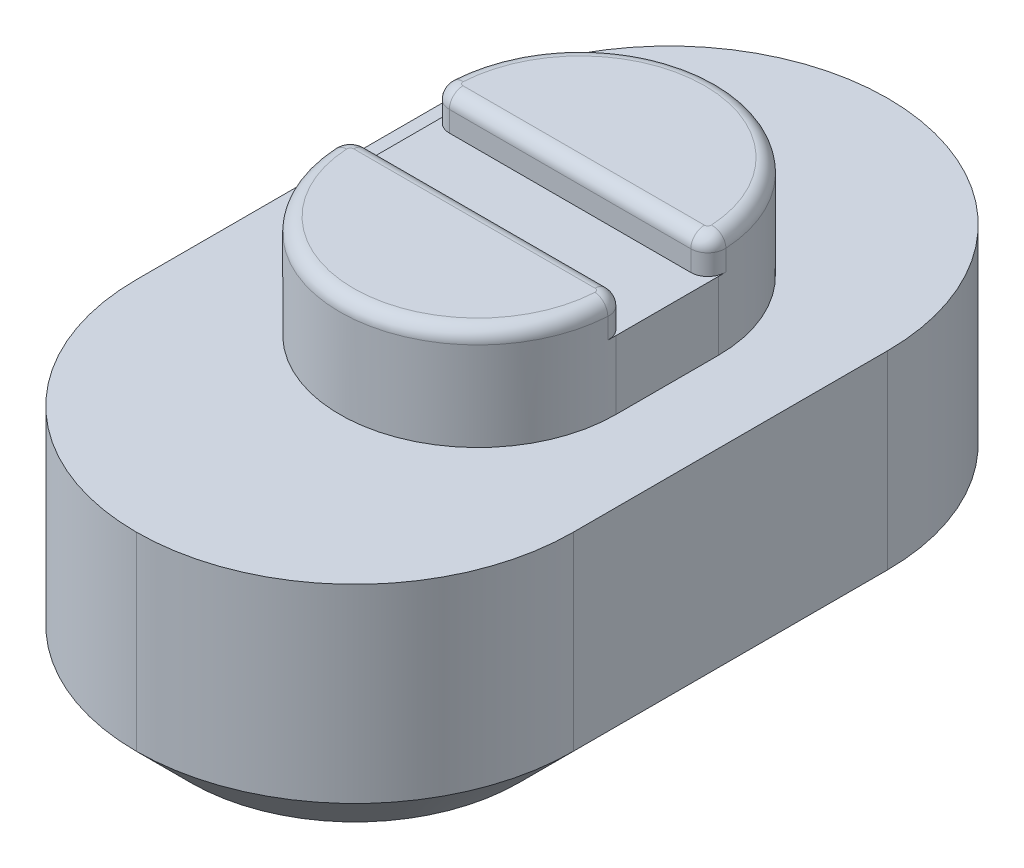
from build123d import *

# Parameters (mm, degrees)
SKETCH_1_W              = 6.4
SKETCH_1_H              = 11
EXTRUDE_1_DEPTH         = 3.678333878
FILLET_1_R              = 3.2
EXTRUDE_2_DEPTH         = 1.5
SKETCH_3_W              = 4.04000003
SKETCH_3_H              = 1.2
CUT_EXTRUDE_1_DEPTH     = 0.5
FILLET_2_R              = 0.25
FILLET_3_R              = 0.2
OTHER_2_OUTLINE_W       = 1.5
OTHER_2_OUTLINE_H       = 1.5
OTHER_2_DEPTH           = 2
SKETCH_5_W              = 1.8
SKETCH_5_H              = 1.8
CUT_EXTRUDE_2_DEPTH     = 5.4
CUT_EXTRUDE_START       = -0.1
CUT_EXTRUDE_3_OUTLINE_W = 10
CUT_EXTRUDE_3_OUTLINE_H = 14
CUT_EXTRUDE_3_DEPTH     = 0.1
CHAMFER_1_SIZE          = 0.8


# Read off the part's stored shape, not the designer's step: 压凹2, 切除-拉伸3
# Some blends are built 0.0001 mm under size
with BuildPart() as part:
    # 草图1 → 凸台-拉伸1 (new body)
    with BuildSketch(Plane(origin=(0, 0, 0), x_dir=(1, 0, 0), z_dir=(0, 1, 0))):
        Rectangle(SKETCH_1_W, SKETCH_1_H)
    extrude(amount=EXTRUDE_1_DEPTH)

    # 圆角1
    fillet_1_edges = [part.edges().sort_by_distance(p)[0] for p in [
        (-3.2, 1.839166939, -5.5),
        (3.2, 1.839166939, -5.5),
        (3.2, 1.839166939, 5.5),
        (-3.2, 1.839166939, 5.5),
    ]]
    fillet(fillet_1_edges, radius=FILLET_1_R - 0.0001)  # a hair under: the kernel refuses the full size

    # 草图2 → 凸台-拉伸2 (add)
    with BuildSketch(Plane(origin=(0, 3.678333878, 0), x_dir=(1, 0, 0), z_dir=(0, 1, 0))):
        with BuildLine():
            Line((2.020000015, 1), (2.020000015, -0.5))
            ThreePointArc((2.020000015, -0.5), (0, -2.520000015), (-2.020000015, -0.5))
            Line((-2.020000015, -0.5), (-2.020000015, 1))
            ThreePointArc((-2.020000015, 1), (1.5e-08, 3.02), (2.020000015, 1))
        make_face()
    extrude(amount=EXTRUDE_2_DEPTH)

    # 草图3 → 切除-拉伸1 (cut)
    with BuildSketch(Plane(origin=(0, 5.178333878, 0), x_dir=(1, 0, 0), z_dir=(0, 1, 0))):
        with Locations((0, 0.25)):
            Rectangle(SKETCH_3_W, SKETCH_3_H)
    extrude(amount=-CUT_EXTRUDE_1_DEPTH, mode=Mode.SUBTRACT)

    # 圆角2
    # the kernel refuses this fillet: 0.25 mm, written as the material it takes off along each edge
    with BuildSketch(Plane(origin=(2.020000015, 5.838693877, 0.35), x_dir=(-0.012214651008913897, 0, 0.9999253983676635), z_dir=(0, -1, 0))) as fillet_2_piece_1:
        with BuildLine():
            CenterArc((0.253069545, 0.249754592), FILLET_2_R, 179.300134646, 93.238774214)
            Line((0.003088195, 0.252808255), (-0.02190994, 0.253113621))
            Line((-0.02190994, 0.253113621), (-0.024998135, 0.000305366))
            Line((-0.024998135, 0.000305366), (-0.000305366, -0.024998135))
            ThreePointArc((-0.000305366, -0.024998135), (0.149683443, -0.026830333), (0.265251445, -0.024975459))
            Line((0.265251445, -0.024975459), (0.264143999, 0))
        make_face()
    extrude(amount=1.160359998, mode=Mode.SUBTRACT)
    with BuildSketch(Plane(origin=(2.020000015, 5.838693882, -0.85), x_dir=(-0.012214654567378504, 0, -0.9999253983241949), z_dir=(0, -1, 0))) as fillet_2_piece_2:
        with BuildLine():
            CenterArc((0.253069545, -0.249754592), FILLET_2_R, 87.46109086, 93.238774699)
            Line((0.003088196, -0.252808256), (-0.021909939, -0.253113622))
            Line((-0.021909939, -0.253113622), (-0.024998135, -0.000305366))
            Line((-0.024998135, -0.000305366), (-0.000305366, 0.024998135))
            ThreePointArc((-0.000305366, 0.024998135), (0.149683444, 0.026830333), (0.265251447, 0.024975459))
            Line((0.265251447, 0.024975459), (0.264144001, 0))
        make_face()
    extrude(amount=1.160360003, mode=Mode.SUBTRACT)
    with BuildSketch(Plane(origin=(-2.020000015, 5.838693877, 0.35), x_dir=(0.012214651008913804, 0, 0.9999253983676635), z_dir=(0, -1, 0))) as fillet_2_piece_3:
        with BuildLine():
            CenterArc((0.253069545, -0.249754592), FILLET_2_R, 87.461091141, 93.238774214)
            Line((0.003088195, -0.252808255), (-0.02190994, -0.253113621))
            Line((-0.02190994, -0.253113621), (-0.024998135, -0.000305366))
            Line((-0.024998135, -0.000305366), (-0.000305366, 0.024998135))
            ThreePointArc((-0.000305366, 0.024998135), (0.149683443, 0.026830333), (0.265251445, 0.024975459))
            Line((0.265251445, 0.024975459), (0.264143999, 0))
        make_face()
    extrude(amount=1.160359998, mode=Mode.SUBTRACT)
    with BuildSketch(Plane(origin=(-2.020000015, 5.838693882, -0.85), x_dir=(0.012214654567376798, 0, -0.9999253983241947), z_dir=(0, -1, 0))) as fillet_2_piece_4:
        with BuildLine():
            CenterArc((0.253069545, 0.249754592), FILLET_2_R, 179.300134442, 93.238774699)
            Line((0.003088196, 0.252808256), (-0.021909939, 0.253113622))
            Line((-0.021909939, 0.253113622), (-0.024998135, 0.000305366))
            Line((-0.024998135, 0.000305366), (-0.000305366, -0.024998135))
            ThreePointArc((-0.000305366, -0.024998135), (0.149683444, -0.026830333), (0.265251447, -0.024975459))
            Line((0.265251447, -0.024975459), (0.264144001, 0))
        make_face()
    extrude(amount=1.160360003, mode=Mode.SUBTRACT)

    # 圆角3
    fillet_3_edges = [part.edges().sort_by_distance(p)[0] for p in [
        (0, 5.178333878, 2.520000015),
        (0, 5.178333878, 0.35),
        (-1.948874678, 5.178333878, 0.428289595),
        (1.948874678, 5.178333878, 0.428289595),
        (0, 5.178333878, -0.85),
        (0, 5.178333878, -3.02),
        (-1.948874678, 5.178333878, -0.928289595),
        (1.948874678, 5.178333878, -0.928289595),
    ]]
    fillet(fillet_3_edges, radius=FILLET_3_R)

    # 压凹2 outline → 压凹2 (cut)
    with BuildSketch(Plane(origin=(0, 0, 0), x_dir=(1, 0, 0), z_dir=(0, 1, 0))):
        with Locations((0, 1)):
            Rectangle(OTHER_2_OUTLINE_W, OTHER_2_OUTLINE_H)
    extrude(amount=OTHER_2_DEPTH, mode=Mode.SUBTRACT)

    # 草图5 → 切除-拉伸2 (cut)
    with BuildSketch(Plane.XZ.offset(-2)):
        with Locations((0, -1)):
            Rectangle(SKETCH_5_W, SKETCH_5_H)
    extrude(amount=CUT_EXTRUDE_2_DEPTH, mode=Mode.SUBTRACT)

    # 切除-拉伸3 outline → 切除-拉伸3 (cut)
    with BuildSketch(Plane.XZ.offset(CUT_EXTRUDE_START)):
        Rectangle(CUT_EXTRUDE_3_OUTLINE_W, CUT_EXTRUDE_3_OUTLINE_H)
    extrude(amount=CUT_EXTRUDE_3_DEPTH, mode=Mode.SUBTRACT)

    # 倒角1
    chamfer_1_edges = [part.edges().sort_by_distance(p)[0] for p in [
        (2.262770989, 0.1, 4.562770989),
        (-2.262770989, 0.1, -4.562770989),
        (-2.262770989, 0.1, 4.562770989),
        (3.2, 0.1, 0),
        (2.262770989, 0.1, -4.562770989),
        (-3.2, 0.1, 0),
    ]]
    chamfer(chamfer_1_edges, length=CHAMFER_1_SIZE)


solid = part.part
